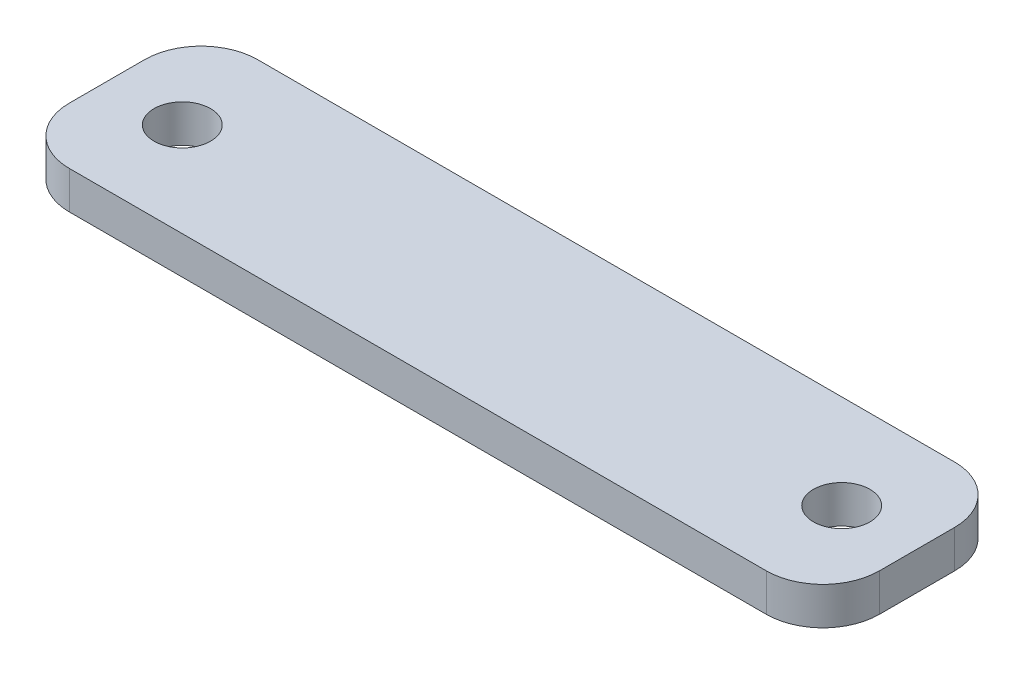
from build123d import *

# Parameters (mm, degrees)
SKETCH1_W             = 43
SKETCH1_H             = 10
BOSS_EXTRUDE1_DEPTH   = 2
FILLET1_R             = 3
F_3_0MM_DOWEL_HOLE1_D = 3


with BuildPart() as part:
    # Sketch1 → Boss-Extrude1 (new body)
    with BuildSketch(Plane(origin=(0, 0, 0), x_dir=(1, 0, 0), z_dir=(0, 1, 0))):
        Rectangle(SKETCH1_W, SKETCH1_H)
    extrude(amount=BOSS_EXTRUDE1_DEPTH)

    # Fillet1
    fillet1_edges = [part.edges().sort_by_distance(p)[0] for p in [
        (21.5, 1, 5),
        (21.5, 1, -5),
        (-21.5, 1, 5),
        (-21.5, 1, -5),
    ]]
    fillet(fillet1_edges, radius=FILLET1_R)

    # Ø3.0mm Dowel Hole1 (through all)
    with Locations(Plane(origin=(0, 0, 0), x_dir=(-1, 0, 0), z_dir=(0, -1, 0))):
        with Locations((-17.5, 0), (17.5, 0)):
            Hole(F_3_0MM_DOWEL_HOLE1_D / 2)


solid = part.part
